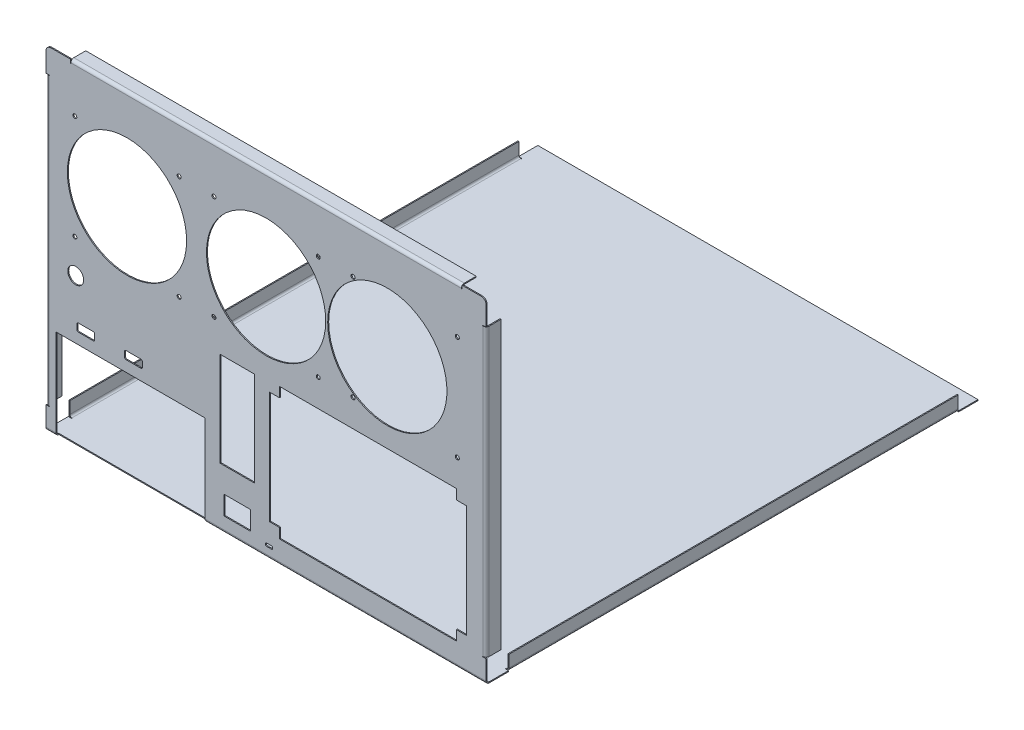
from build123d import *

# Parameters (mm, degrees)
BASE_FLANGE1_DEPTH              = 1
EDGE_FLANGE1_STRIP_W            = 8
EDGE_FLANGE1_STRIP_H            = 1
EDGE_FLANGE1_STRIP_CUT_DEPTH    = 443
EDGE_FLANGE1_DEPTH              = 443
CUT_EXTRUDE1_START              = -3
CUT_EXTRUDE1_OUTLINE_W          = 150
CUT_EXTRUDE1_OUTLINE_H          = 93
CUT_EXTRUDE1_OUTLINE_R          = 60
CUT_EXTRUDE1_OUTLINE_R_2        = 2
CUT_EXTRUDE1_OUTLINE_W_2        = 27
CUT_EXTRUDE1_OUTLINE_H_2        = 19
CUT_EXTRUDE1_OUTLINE_W_3        = 34.5
CUT_EXTRUDE1_OUTLINE_H_3        = 95
CUT_EXTRUDE1_OUTLINE_R_3        = 8
CUT_EXTRUDE1_DEPTH              = 3
EDGE_FLANGE3_STRIP_W            = 8
EDGE_FLANGE3_STRIP_H            = 1
EDGE_FLANGE3_STRIP_CUT_DEPTH    = 288
EDGE_FLANGE3_RELIEF_W           = 8.5
EDGE_FLANGE3_RELIEF_H           = 0.5
EDGE_FLANGE3_RELIEF_CUT_DEPTH   = 1
EDGE_FLANGE3_STRIP_2_W          = 8
EDGE_FLANGE3_STRIP_2_H          = 1
EDGE_FLANGE3_STRIP_CUT_2_DEPTH  = 393
EDGE_FLANGE3_RELIEF_2_W         = 8.5
EDGE_FLANGE3_RELIEF_2_H         = 0.5
EDGE_FLANGE3_RELIEF_CUT_2_DEPTH = 1
EDGE_FLANGE3_STRIP_3_W          = 8
EDGE_FLANGE3_STRIP_3_H          = 1
EDGE_FLANGE3_STRIP_CUT_3_DEPTH  = 288
EDGE_FLANGE3_RELIEF_3_W         = 8.5
EDGE_FLANGE3_RELIEF_3_H         = 0.5
EDGE_FLANGE3_RELIEF_CUT_3_DEPTH = 1
EDGE_FLANGE3_DEPTH              = 288
EDGE_FLANGE3_BEND_DEPTH         = 393
EDGE_FLANGE3_BEND_2_DEPTH       = 288
EDGE_FLANGE4_STRIP_W            = 8
EDGE_FLANGE4_STRIP_H            = 1
EDGE_FLANGE4_STRIP_CUT_DEPTH    = 452
EDGE_FLANGE4_RELIEF_W           = 8.5
EDGE_FLANGE4_RELIEF_H           = 0.5
EDGE_FLANGE4_RELIEF_CUT_DEPTH   = 1
EDGE_FLANGE4_STRIP_2_W          = 8
EDGE_FLANGE4_STRIP_2_H          = 1
EDGE_FLANGE4_STRIP_CUT_2_DEPTH  = 452
EDGE_FLANGE4_RELIEF_2_W         = 8.5
EDGE_FLANGE4_RELIEF_2_H         = 0.5
EDGE_FLANGE4_RELIEF_CUT_2_DEPTH = 1
EDGE_FLANGE4_DEPTH              = 452
EDGE_FLANGE4_BEND_DEPTH         = 452


# Read off the part's stored shape, not the designer's step: Cut-Extrude1
# Sheet-metal steps are written as plain solids
with BuildPart() as part:
    # Sketch1 → Base-Flange1 (new body)
    with BuildSketch(Plane.XY):
        with BuildLine():
            Line((0, 0), (443, 0))
            Line((443, 0), (443, 331))
            ThreePointArc((443, 331), (441.535533906, 334.535533906), (438, 336))
            Line((438, 336), (5, 336))
            ThreePointArc((5, 336), (1.464466094, 334.535533906), (0, 331))
            Line((0, 331), (0, 0))
        make_face()
    extrude(amount=-BASE_FLANGE1_DEPTH)

    # Edge-Flange1 strip (across the edge) → Edge-Flange1 strip cut (cut)
    with BuildSketch(Plane(origin=(443, 0, -1), x_dir=(0, 1, 0), z_dir=(-1, 0, 0))):
        with Locations((-1, -0.5)):
            Rectangle(EDGE_FLANGE1_STRIP_W, EDGE_FLANGE1_STRIP_H)
    extrude(amount=EDGE_FLANGE1_STRIP_CUT_DEPTH, mode=Mode.SUBTRACT)

    # Edge-Flange1 section (across the edge) → Edge-Flange1 (add)
    with BuildSketch(Plane(origin=(443, 0, -1), x_dir=(0, 1, 0), z_dir=(-1, 0, 0))):
        with BuildLine():
            Line((0, 2), (0, 494))
            Line((0, 494), (1, 494))
            Line((1, 494), (1, 2))
            ThreePointArc((1, 2), (1.585786438, 0.585786438), (3, 0))
            Line((3, 0), (3, -1))
            ThreePointArc((3, -1), (0.878679656, -0.121320344), (0, 2))
        make_face()
    extrude(amount=EDGE_FLANGE1_DEPTH)

    # Cut-Extrude1 outline → Cut-Extrude1 (cut)
    with BuildSketch(Plane.XY.offset(CUT_EXTRUDE1_START)):
        with Locations((85, 44.5)):
            Rectangle(CUT_EXTRUDE1_OUTLINE_W, CUT_EXTRUDE1_OUTLINE_H)
        with Locations((81.5, 236)):
            Circle(CUT_EXTRUDE1_OUTLINE_R)
        with Locations((274, 288.5)):
            Circle(CUT_EXTRUDE1_OUTLINE_R_2)
        with Locations((309, 288.5)):
            Circle(CUT_EXTRUDE1_OUTLINE_R_2)
        with Locations((414, 288.5)):
            Circle(CUT_EXTRUDE1_OUTLINE_R_2)
        with Locations((414, 183.5)):
            Circle(CUT_EXTRUDE1_OUTLINE_R_2)
        with Locations((309, 183.5)):
            Circle(CUT_EXTRUDE1_OUTLINE_R_2)
        with BuildLine():
            ThreePointArc((95.5, 102), (96.560660172, 102.439339828), (97, 103.5))
            Line((97, 103.5), (97, 108.5))
            ThreePointArc((97, 108.5), (96.560660172, 109.560660172), (95.5, 110))
            Line((95.5, 110), (80.5, 110))
            ThreePointArc((80.5, 110), (79.439339828, 109.560660172), (79, 108.5))
            Line((79, 108.5), (79, 103.5))
            ThreePointArc((79, 103.5), (79.439339828, 102.439339828), (80.5, 102))
            Line((80.5, 102), (95.5, 102))
        make_face()
        with BuildLine():
            ThreePointArc((31, 103.5), (31.439339828, 102.439339828), (32.5, 102))
            Line((32.5, 102), (47.5, 102))
            ThreePointArc((47.5, 102), (48.560660172, 102.439339828), (49, 103.5))
            Line((49, 103.5), (49, 108.5))
            ThreePointArc((49, 108.5), (48.560660172, 109.560660172), (47.5, 110))
            Line((47.5, 110), (32.5, 110))
            ThreePointArc((32.5, 110), (31.439339828, 109.560660172), (31, 108.5))
            Line((31, 108.5), (31, 103.5))
        make_face()
        with Locations((29, 183.5)):
            Circle(CUT_EXTRUDE1_OUTLINE_R_2)
        with Locations((134, 183.5)):
            Circle(CUT_EXTRUDE1_OUTLINE_R_2)
        with Locations((169, 183.5)):
            Circle(CUT_EXTRUDE1_OUTLINE_R_2)
        with Locations((274, 183.5)):
            Circle(CUT_EXTRUDE1_OUTLINE_R_2)
        with BuildLine():
            ThreePointArc((228, 12), (227.707106781, 12.707106781), (227, 13))
            Line((227, 13), (222, 13))
            ThreePointArc((222, 13), (221.292893219, 12.707106781), (221, 12))
            Line((221, 12), (221, 11))
            ThreePointArc((221, 11), (221.292893219, 10.292893219), (222, 10))
            Line((222, 10), (227, 10))
            ThreePointArc((227, 10), (227.707106781, 10.292893219), (228, 11))
            Line((228, 11), (228, 12))
        make_face()
        Polygon((235, 156), (235, 146), (225, 146), (225, 33), (235, 33), (235, 23), (413, 23), (413, 33), (423, 33), (423, 146), (413, 146), (413, 156), align=None)
        with Locations((221.5, 236)):
            Circle(CUT_EXTRUDE1_OUTLINE_R)
        with Locations((29, 288.5)):
            Circle(CUT_EXTRUDE1_OUTLINE_R_2)
        with Locations((134, 288.5)):
            Circle(CUT_EXTRUDE1_OUTLINE_R_2)
        with Locations((169, 288.5)):
            Circle(CUT_EXTRUDE1_OUTLINE_R_2)
        with Locations((192.5, 24.583858475)):
            Rectangle(CUT_EXTRUDE1_OUTLINE_W_2, CUT_EXTRUDE1_OUTLINE_H_2)
        with Locations((192.5, 106.583858475)):
            Rectangle(CUT_EXTRUDE1_OUTLINE_W_3, CUT_EXTRUDE1_OUTLINE_H_3)
        with Locations((29.884586672, 150)):
            Circle(CUT_EXTRUDE1_OUTLINE_R_3)
        with Locations((343.5, 236)):
            Circle(CUT_EXTRUDE1_OUTLINE_R)
    extrude(amount=CUT_EXTRUDE1_DEPTH, mode=Mode.SUBTRACT)

    # Edge-Flange3 strip (across the edge) → Edge-Flange3 strip cut (cut)
    with BuildSketch(Plane(origin=(0, 23, -1), x_dir=(1, 0, 0), z_dir=(0, 1, 0))):
        with Locations((-1, -0.5)):
            Rectangle(EDGE_FLANGE3_STRIP_W, EDGE_FLANGE3_STRIP_H)
    extrude(amount=EDGE_FLANGE3_STRIP_CUT_DEPTH, mode=Mode.SUBTRACT)

    # Edge-Flange3 relief (on the sheet) → Edge-Flange3 relief cut (cut)
    with BuildSketch(Plane(origin=(3, 23, -1), x_dir=(1, 0, 0), z_dir=(0, 0, -1))):
        with Locations((-3.75, 0.25)):
            Rectangle(EDGE_FLANGE3_RELIEF_W, EDGE_FLANGE3_RELIEF_H)
        with Locations((-3.75, -288.25)):
            Rectangle(EDGE_FLANGE3_RELIEF_W, EDGE_FLANGE3_RELIEF_H)
    extrude(amount=-EDGE_FLANGE3_RELIEF_CUT_DEPTH, mode=Mode.SUBTRACT)

    # Edge-Flange3 strip 2 (across the edge) → Edge-Flange3 strip cut 2 (cut)
    with BuildSketch(Plane(origin=(25, 336, -1), x_dir=(0, -1, 0), z_dir=(1, 0, 0))):
        with Locations((-1, -0.5)):
            Rectangle(EDGE_FLANGE3_STRIP_2_W, EDGE_FLANGE3_STRIP_2_H)
    extrude(amount=EDGE_FLANGE3_STRIP_CUT_2_DEPTH, mode=Mode.SUBTRACT)

    # Edge-Flange3 relief 2 (on the sheet) → Edge-Flange3 relief cut 2 (cut)
    with BuildSketch(Plane(origin=(25, 333, -1), x_dir=(0, -1, 0), z_dir=(0, 0, -1))):
        with Locations((-3.75, 0.25)):
            Rectangle(EDGE_FLANGE3_RELIEF_2_W, EDGE_FLANGE3_RELIEF_2_H)
        with Locations((-3.75, -393.25)):
            Rectangle(EDGE_FLANGE3_RELIEF_2_W, EDGE_FLANGE3_RELIEF_2_H)
    extrude(amount=-EDGE_FLANGE3_RELIEF_CUT_2_DEPTH, mode=Mode.SUBTRACT)

    # Edge-Flange3 strip 3 (across the edge) → Edge-Flange3 strip cut 3 (cut)
    with BuildSketch(Plane(origin=(443, 311, -1), x_dir=(-1, 0, 0), z_dir=(0, -1, 0))):
        with Locations((-1, -0.5)):
            Rectangle(EDGE_FLANGE3_STRIP_3_W, EDGE_FLANGE3_STRIP_3_H)
    extrude(amount=EDGE_FLANGE3_STRIP_CUT_3_DEPTH, mode=Mode.SUBTRACT)

    # Edge-Flange3 relief 3 (on the sheet) → Edge-Flange3 relief cut 3 (cut)
    with BuildSketch(Plane(origin=(440, 311, -1), x_dir=(-1, 0, 0), z_dir=(0, 0, -1))):
        with Locations((-3.75, 0.25)):
            Rectangle(EDGE_FLANGE3_RELIEF_3_W, EDGE_FLANGE3_RELIEF_3_H)
        with Locations((-3.75, -288.25)):
            Rectangle(EDGE_FLANGE3_RELIEF_3_W, EDGE_FLANGE3_RELIEF_3_H)
    extrude(amount=-EDGE_FLANGE3_RELIEF_CUT_3_DEPTH, mode=Mode.SUBTRACT)

    # Edge-Flange3 section (across the edge) → Edge-Flange3 (add)
    with BuildSketch(Plane(origin=(0, 23, -1), x_dir=(1, 0, 0), z_dir=(0, 1, 0))):
        with BuildLine():
            Line((0, 2), (0, 14))
            Line((0, 14), (1, 14))
            Line((1, 14), (1, 2))
            ThreePointArc((1, 2), (1.585786438, 0.585786438), (3, 0))
            Line((3, 0), (3, -1))
            ThreePointArc((3, -1), (0.878679656, -0.121320344), (0, 2))
        make_face()
    extrude(amount=EDGE_FLANGE3_DEPTH)

    # Edge-Flange3 section 2 (across the edge) → Edge-Flange3 bend (add)
    with BuildSketch(Plane(origin=(25, 336, -1), x_dir=(0, -1, 0), z_dir=(1, 0, 0))):
        with BuildLine():
            Line((0, 2), (0, 14))
            Line((0, 14), (1, 14))
            Line((1, 14), (1, 2))
            ThreePointArc((1, 2), (1.585786438, 0.585786438), (3, 0))
            Line((3, 0), (3, -1))
            ThreePointArc((3, -1), (0.878679656, -0.121320344), (0, 2))
        make_face()
    extrude(amount=EDGE_FLANGE3_BEND_DEPTH)

    # Edge-Flange3 section 3 (across the edge) → Edge-Flange3 bend 2 (add)
    with BuildSketch(Plane(origin=(443, 311, -1), x_dir=(-1, 0, 0), z_dir=(0, -1, 0))):
        with BuildLine():
            Line((0, 2), (0, 14))
            Line((0, 14), (1, 14))
            Line((1, 14), (1, 2))
            ThreePointArc((1, 2), (1.585786438, 0.585786438), (3, 0))
            Line((3, 0), (3, -1))
            ThreePointArc((3, -1), (0.878679656, -0.121320344), (0, 2))
        make_face()
    extrude(amount=EDGE_FLANGE3_BEND_2_DEPTH)

    # Edge-Flange4 strip (across the edge) → Edge-Flange4 strip cut (cut)
    with BuildSketch(Plane(origin=(443, 1, -23), x_dir=(-1, 0, 0), z_dir=(0, 0, -1))):
        with Locations((-1, -0.5)):
            Rectangle(EDGE_FLANGE4_STRIP_W, EDGE_FLANGE4_STRIP_H)
    extrude(amount=EDGE_FLANGE4_STRIP_CUT_DEPTH, mode=Mode.SUBTRACT)

    # Edge-Flange4 relief (on the sheet) → Edge-Flange4 relief cut (cut)
    with BuildSketch(Plane(origin=(440, 1, -23), x_dir=(-1, 0, 0), z_dir=(0, 1, 0))):
        with Locations((-3.75, 0.25)):
            Rectangle(EDGE_FLANGE4_RELIEF_W, EDGE_FLANGE4_RELIEF_H)
        with Locations((-3.75, -452.25)):
            Rectangle(EDGE_FLANGE4_RELIEF_W, EDGE_FLANGE4_RELIEF_H)
    extrude(amount=-EDGE_FLANGE4_RELIEF_CUT_DEPTH, mode=Mode.SUBTRACT)

    # Edge-Flange4 strip 2 (across the edge) → Edge-Flange4 strip cut 2 (cut)
    with BuildSketch(Plane(origin=(0, 1, -475), x_dir=(1, 0, 0), z_dir=(0, 0, 1))):
        with Locations((-1, -0.5)):
            Rectangle(EDGE_FLANGE4_STRIP_2_W, EDGE_FLANGE4_STRIP_2_H)
    extrude(amount=EDGE_FLANGE4_STRIP_CUT_2_DEPTH, mode=Mode.SUBTRACT)

    # Edge-Flange4 relief 2 (on the sheet) → Edge-Flange4 relief cut 2 (cut)
    with BuildSketch(Plane(origin=(3, 1, -475), x_dir=(1, 0, 0), z_dir=(0, 1, 0))):
        with Locations((-3.75, 0.25)):
            Rectangle(EDGE_FLANGE4_RELIEF_2_W, EDGE_FLANGE4_RELIEF_2_H)
        with Locations((-3.75, -452.25)):
            Rectangle(EDGE_FLANGE4_RELIEF_2_W, EDGE_FLANGE4_RELIEF_2_H)
    extrude(amount=-EDGE_FLANGE4_RELIEF_CUT_2_DEPTH, mode=Mode.SUBTRACT)

    # Edge-Flange4 section (across the edge) → Edge-Flange4 (add)
    with BuildSketch(Plane(origin=(443, 1, -23), x_dir=(-1, 0, 0), z_dir=(0, 0, -1))):
        with BuildLine():
            Line((0, 2), (0, 14))
            Line((0, 14), (1, 14))
            Line((1, 14), (1, 2))
            ThreePointArc((1, 2), (1.585786438, 0.585786438), (3, 0))
            Line((3, 0), (3, -1))
            ThreePointArc((3, -1), (0.878679656, -0.121320344), (0, 2))
        make_face()
    extrude(amount=EDGE_FLANGE4_DEPTH)

    # Edge-Flange4 section 2 (across the edge) → Edge-Flange4 bend (add)
    with BuildSketch(Plane(origin=(0, 1, -475), x_dir=(1, 0, 0), z_dir=(0, 0, 1))):
        with BuildLine():
            Line((0, 2), (0, 14))
            Line((0, 14), (1, 14))
            Line((1, 14), (1, 2))
            ThreePointArc((1, 2), (1.585786438, 0.585786438), (3, 0))
            Line((3, 0), (3, -1))
            ThreePointArc((3, -1), (0.878679656, -0.121320344), (0, 2))
        make_face()
    extrude(amount=EDGE_FLANGE4_BEND_DEPTH)


solid = part.part
